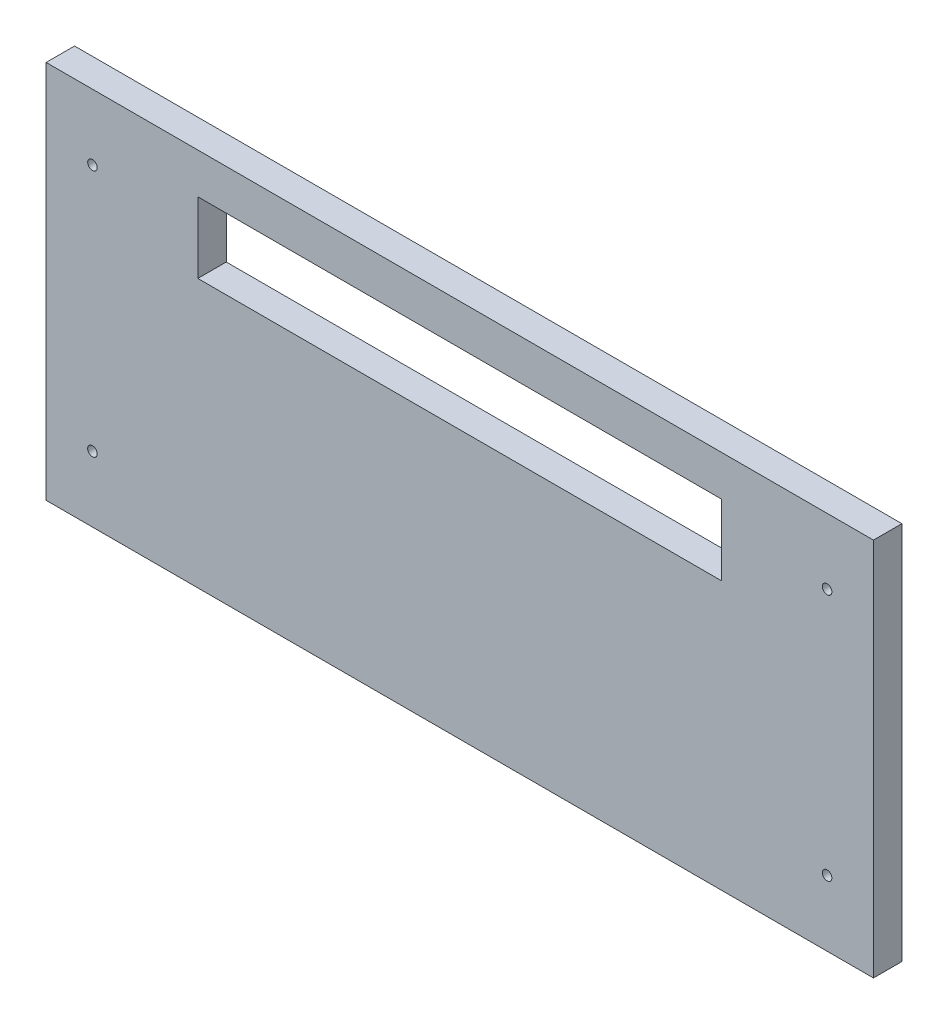
from build123d import *

# Parameters (mm, degrees)
SKETCH1_W                 = 277.05
SKETCH1_H                 = 127
SKETCH1_R                 = 1.6
WALL_DEPTH                = 9.525
CANNULUSLARGECUTOUT_REACH = 306.92
SKETCH3_W                 = 175.45
SKETCH3_H                 = 23.688591212


with BuildPart() as part:
    # Sketch1 → Wall (new body)
    with BuildSketch(Plane.XY):
        with Locations((138.525, 63.5)):
            Rectangle(SKETCH1_W, SKETCH1_H)
        with Locations((15.525, 105)):
            Circle(SKETCH1_R, mode=Mode.SUBTRACT)
        with Locations((15.525, 22)):
            Circle(SKETCH1_R, mode=Mode.SUBTRACT)
        with Locations((261.525, 105)):
            Circle(SKETCH1_R, mode=Mode.SUBTRACT)
        with Locations((261.525, 22)):
            Circle(SKETCH1_R, mode=Mode.SUBTRACT)
    extrude(amount=WALL_DEPTH)

    # Sketch3 → CannulusLargeCutout (cut, up to next)
    with BuildSketch(Plane.XY.offset(9.525), mode=Mode.PRIVATE) as cannuluslargecutout_sk1:
        with Locations((138.525, 101.6)):
            Rectangle(SKETCH3_W, SKETCH3_H)
    cannuluslargecutout_tool1 = extrude(cannuluslargecutout_sk1.sketch, amount=-CANNULUSLARGECUTOUT_REACH, mode=Mode.PRIVATE) & part.part
    add(cannuluslargecutout_tool1.solids().sort_by_distance((138.525, 101.6, 9.525))[0], mode=Mode.SUBTRACT)


solid = part.part
